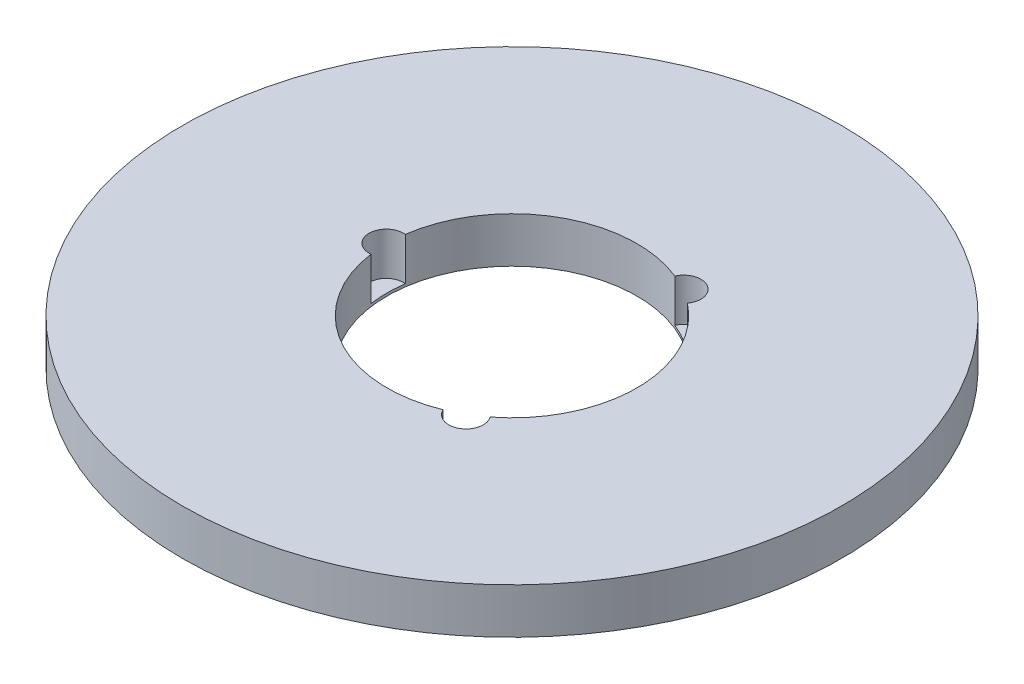
from build123d import *

# Parameters (mm, degrees)
SKETCH1_R           = 72.5
BOSS_EXTRUDE1_DEPTH = 10
SKETCH2_R           = 27.5
CUT_EXTRUDE1_DEPTH  = 104.01698889
SKETCH3_R           = 3.802071798
CUT_EXTRUDE2_DEPTH  = 9.395065153
CIRPATTERN1_COUNT   = 3


with BuildPart() as part:
    # Sketch1 → Boss-Extrude1 (new body)
    with BuildSketch(Plane(origin=(0, 0, 0), x_dir=(1, 0, 0), z_dir=(0, 1, 0))):
        Circle(SKETCH1_R)
    extrude(amount=BOSS_EXTRUDE1_DEPTH)

    # Sketch2 → Cut-Extrude1 (cut, through all)
    with BuildSketch(Plane(origin=(0, 0, 0), x_dir=(1, 0, 0), z_dir=(0, 1, 0))):
        Circle(SKETCH2_R)
    extrude(amount=CUT_EXTRUDE1_DEPTH, mode=Mode.SUBTRACT)

    # Sketch3 → Cut-Extrude2 (cut)
    with BuildSketch(Plane(origin=(0, 10, 0), x_dir=(1, 0, 0), z_dir=(0, 1, 0))):
        with Locations((-27.643058682, 0)):
            Circle(SKETCH3_R)
    cut_extrude2 = extrude(amount=-CUT_EXTRUDE2_DEPTH, mode=Mode.SUBTRACT)

    # CirPattern1: Cut-Extrude2 ×3 about axis
    cirpattern1_axis = Axis((0, 0, 0), (0, 1, 0))
    for i in range(1, CIRPATTERN1_COUNT):
        add(cut_extrude2.rotate(cirpattern1_axis, i * 360 / CIRPATTERN1_COUNT), mode=Mode.SUBTRACT)


solid = part.part
